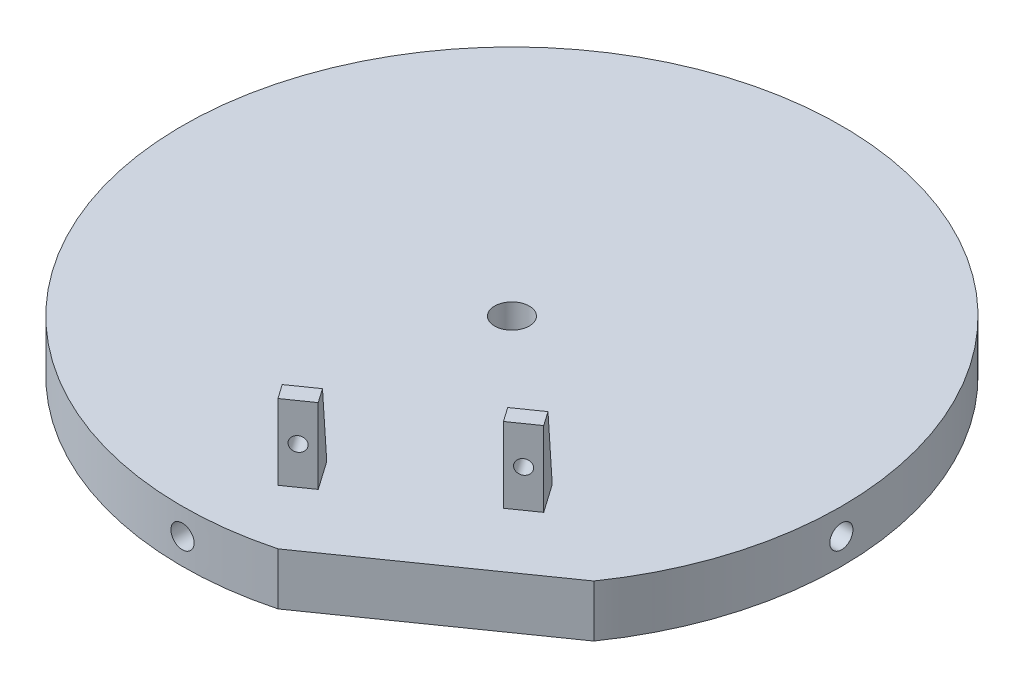
from build123d import *
from OCP.BRepFilletAPI import BRepFilletAPI_MakeChamfer

# Parameters (mm, degrees)
SKETCH1_R                           = 57
BOSS_EXTRUDE1_DEPTH                 = 4.5
F_4_0MM_DOWEL_HOLE1_D               = 4
F_4_0MM_DOWEL_HOLE1_DEPTH           = 10
F_4_0MM_DOWEL_HOLE1_TIP             = 1.201721238
F_4_0MM_DOWEL_HOLE1_ON_FACE_2_D     = 4
F_4_0MM_DOWEL_HOLE1_ON_FACE_2_DEPTH = 10
F_4_0MM_DOWEL_HOLE1_ON_FACE_2_TIP   = 1.201721238
F_4_0MM_DOWEL_HOLE1_ON_FACE_3_D     = 4
F_4_0MM_DOWEL_HOLE1_ON_FACE_3_DEPTH = 10
F_4_0MM_DOWEL_HOLE1_ON_FACE_3_TIP   = 1.201721238
F_4_0MM_DOWEL_HOLE1_ON_FACE_4_D     = 4
F_4_0MM_DOWEL_HOLE1_ON_FACE_4_DEPTH = 10
F_4_0MM_DOWEL_HOLE1_ON_FACE_4_TIP   = 1.201721238
F_6_0MM_DOWEL_HOLE1_D               = 6
CUT_EXTRUDE1_START                  = -10
CUT_EXTRUDE1_DEPTH                  = 10
BOSS_EXTRUDE2_START                 = -9
BOSS_EXTRUDE2_DEPTH                 = 13
CHAMFER2_SIZE                       = 3
CHAMFER2_SIZE_2                     = 13
F_2_5MM_DOWEL_HOLE1_D               = 2.5


with BuildPart() as part:
    # Sketch1 → Boss-Extrude1 (new, symmetric)
    with BuildSketch(Plane(origin=(0, 0, 0), x_dir=(1, 0, 0), z_dir=(0, 1, 0))):
        with Locations(Location((0, 0, 0), (0, 0, 270))):
            Circle(SKETCH1_R)
    extrude(amount=BOSS_EXTRUDE1_DEPTH, both=True)

    # Ø4.0mm Dowel Hole1
    with Locations(Plane(origin=(0, 0, -57), x_dir=(-1, 0, 0), z_dir=(0, 0, -1))):
        with Locations((0, 0)):
            Hole(F_4_0MM_DOWEL_HOLE1_D / 2, depth=F_4_0MM_DOWEL_HOLE1_DEPTH)
            with Locations((0, 0, -(F_4_0MM_DOWEL_HOLE1_DEPTH + F_4_0MM_DOWEL_HOLE1_TIP / 2))):  # 118° drill point
                Cone(0, F_4_0MM_DOWEL_HOLE1_D / 2, F_4_0MM_DOWEL_HOLE1_TIP, mode=Mode.SUBTRACT)

    # Ø4.0mm Dowel Hole1 on face 2
    with Locations(Plane(origin=(-57, 0, 0), x_dir=(0, 0, -1), z_dir=(-1, 0, 0))):
        with Locations((0, 0)):
            Hole(F_4_0MM_DOWEL_HOLE1_ON_FACE_2_D / 2, depth=F_4_0MM_DOWEL_HOLE1_ON_FACE_2_DEPTH)
            with Locations((0, 0, -(F_4_0MM_DOWEL_HOLE1_ON_FACE_2_DEPTH + F_4_0MM_DOWEL_HOLE1_ON_FACE_2_TIP / 2))):  # 118° drill point
                Cone(0, F_4_0MM_DOWEL_HOLE1_ON_FACE_2_D / 2, F_4_0MM_DOWEL_HOLE1_ON_FACE_2_TIP, mode=Mode.SUBTRACT)

    # Ø4.0mm Dowel Hole1 on face 3
    with Locations(Plane.XY.offset(57)):
        with Locations((0, 0)):
            Hole(F_4_0MM_DOWEL_HOLE1_ON_FACE_3_D / 2, depth=F_4_0MM_DOWEL_HOLE1_ON_FACE_3_DEPTH)
            with Locations((0, 0, -(F_4_0MM_DOWEL_HOLE1_ON_FACE_3_DEPTH + F_4_0MM_DOWEL_HOLE1_ON_FACE_3_TIP / 2))):  # 118° drill point
                Cone(0, F_4_0MM_DOWEL_HOLE1_ON_FACE_3_D / 2, F_4_0MM_DOWEL_HOLE1_ON_FACE_3_TIP, mode=Mode.SUBTRACT)

    # Ø4.0mm Dowel Hole1 on face 4
    with Locations(Plane(origin=(57, 0, 0), x_dir=(0, 0, 1), z_dir=(1, 0, 0))):
        with Locations((0, 0)):
            Hole(F_4_0MM_DOWEL_HOLE1_ON_FACE_4_D / 2, depth=F_4_0MM_DOWEL_HOLE1_ON_FACE_4_DEPTH)
            with Locations((0, 0, -(F_4_0MM_DOWEL_HOLE1_ON_FACE_4_DEPTH + F_4_0MM_DOWEL_HOLE1_ON_FACE_4_TIP / 2))):  # 118° drill point
                Cone(0, F_4_0MM_DOWEL_HOLE1_ON_FACE_4_D / 2, F_4_0MM_DOWEL_HOLE1_ON_FACE_4_TIP, mode=Mode.SUBTRACT)

    # Ø6.0mm Dowel Hole1 (through all)
    with Locations(Plane(origin=(0, 4.5, 0), x_dir=(1, 0, 0), z_dir=(0, 1, 0))):
        with Locations((0, 0)):
            Hole(F_6_0MM_DOWEL_HOLE1_D / 2)

    # Sketch9 → Cut-Extrude1 (cut)
    with BuildSketch(Plane.XZ.offset(4.5).offset(CUT_EXTRUDE1_START)):
        with BuildLine():
            Line((14.64512445, 55.086480463), (46.755431633, 32.60260132))
            ThreePointArc((46.755431633, 32.60260132), (32.693856872, 46.691666524), (14.64512445, 55.086480463))
        make_face()
    extrude(amount=CUT_EXTRUDE1_DEPTH, mode=Mode.SUBTRACT)

    # Sketch9<3> → Boss-Extrude2 (add)
    with BuildSketch(Plane.XZ.offset(4.5).offset(BOSS_EXTRUDE2_START)):
        Polygon((28.056260128, 29.520638865), (32.152020349, 26.652756683), (30.43129104, 24.19530055), (26.335530819, 27.063182732), align=None)
        Polygon((3.399273579, 43.12332295), (7.4950338, 40.255440768), (9.215763109, 42.712896901), (5.120002888, 45.580779083), align=None)
    extrude(amount=-BOSS_EXTRUDE2_DEPTH)

    # Chamfer2
    chamfer2_edges_1 = [part.edges().sort_by_distance(p)[0] for p in [
        (28.38341093, 4.5, 25.629241641),
    ]]
    chamfer2_side_1 = [part.faces().sort_by_distance(p)[0] for p in [
        (28.348996343, 4.5, 25.580092518),
    ]]
    chamfer2_edges_2 = [part.edges().sort_by_distance(p)[0] for p in [
        (5.447153689, 4.5, 41.689381859),
    ]]
    chamfer2_side_2 = [part.faces().sort_by_distance(p)[0] for p in [
        (5.412739103, 4.5, 41.640232736),
    ]]
    chamfer2 = BRepFilletAPI_MakeChamfer(part.part.solid().wrapped)
    for e in chamfer2_edges_1:
        chamfer2.Add(CHAMFER2_SIZE - 0.0001, CHAMFER2_SIZE_2 - 0.0001, e.wrapped, chamfer2_side_1[0].wrapped)
    for e in chamfer2_edges_2:
        chamfer2.Add(CHAMFER2_SIZE - 0.0001, CHAMFER2_SIZE_2 - 0.0001, e.wrapped, chamfer2_side_2[0].wrapped)
    add(Compound.cast(chamfer2.Shape()), mode=Mode.REPLACE)  # a hair under: the kernel refuses the full size

    # Ø2.5mm Dowel Hole1 (through all)
    with Locations(Plane(origin=(23.10039026, 0, 32.990776305), x_dir=(0.8191520442889897, 0, -0.5735764363510493), z_dir=(0.5735764363510493, 0, 0.8191520442889897))):
        with Locations((-19.45, 11), (8.55, 11)):
            Hole(F_2_5MM_DOWEL_HOLE1_D / 2)


solid = part.part
